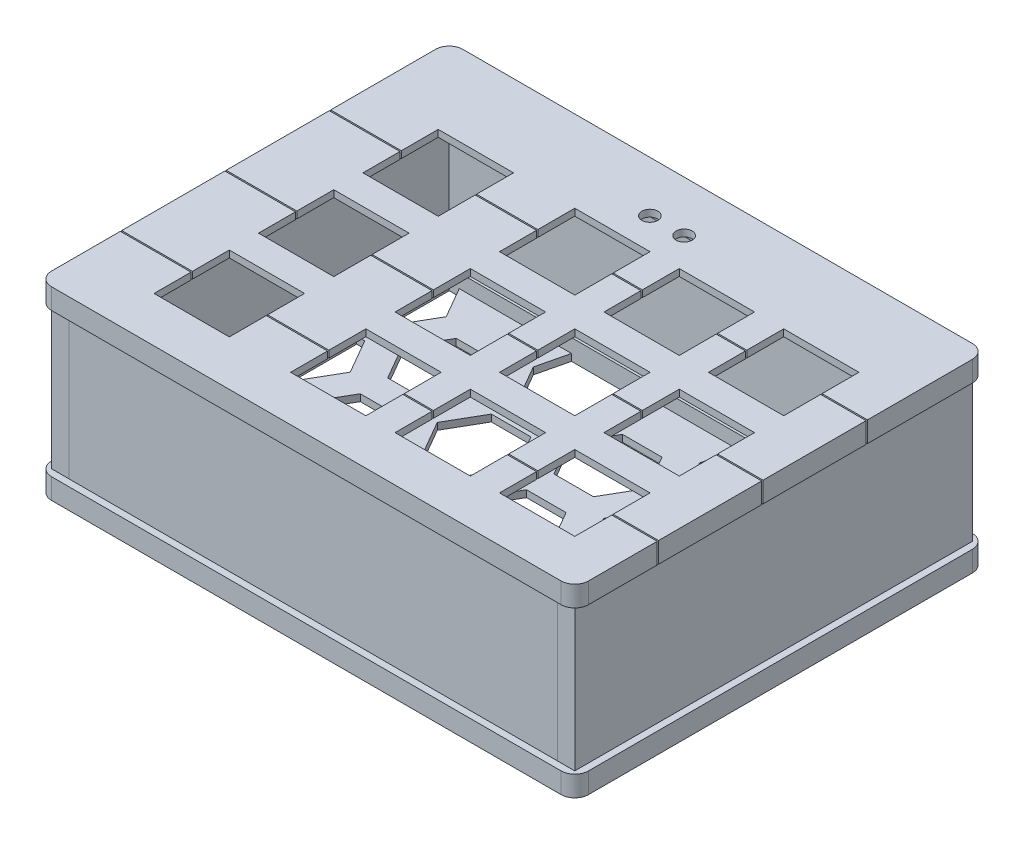
from build123d import *

# Parameters (mm, degrees)
SKETCH1_W               = 99.4664
SKETCH1_H               = 76.2
SKETCH1_W_2             = 13.9446
SKETCH1_H_2             = 13.9446
BOSS_EXTRUDE1_DEPTH     = 1.27
FILLET2_R               = 2.54
FILLET3_R               = 2.54
SKETCH15_W              = 96.9264
SKETCH15_H              = 73.66
SKETCH15_W_2            = 90.5764
SKETCH15_H_2            = 67.31
SKETCH15_W_3            = 88.0364
SKETCH15_H_3            = 64.77
BOSS_EXTRUDE6_DEPTH     = 2.54
SKETCH2_W               = 99.4664
SKETCH2_H               = 0.254
CUT_EXTRUDE_THIN2_DEPTH = 63.765574021
SKETCH10_W              = 94.3864
SKETCH10_H              = 76.2
BOSS_EXTRUDE4_DEPTH     = 1.27
SKETCH16_W              = 3.175
SKETCH16_H              = 73.66
BOSS_EXTRUDE7_DEPTH     = 31.75
BOSS_EXTRUDE7_2_DEPTH   = 31.75
SKETCH17_W              = 90.5764
SKETCH17_H              = 3.175
BOSS_EXTRUDE8_DEPTH     = 31.75
BOSS_EXTRUDE8_2_DEPTH   = 31.75
SKETCH18_W              = 88.0364
SKETCH18_H              = 64.77
BOSS_EXTRUDE9_DEPTH     = 1.27
SKETCH19_W              = 96.9264
SKETCH19_H              = 73.66
SKETCH19_W_2            = 90.5764
SKETCH19_H_2            = 67.31
SKETCH19_W_3            = 88.0364
SKETCH19_H_3            = 64.77
BOSS_EXTRUDE10_DEPTH    = 2.54
BOSS_EXTRUDE11_START    = -1.27
BOSS_EXTRUDE11_DEPTH    = 1.27
SKETCH21_W              = 11.43
SKETCH21_H              = 6.985
CUT_EXTRUDE2_DEPTH      = 3.175
SKETCH22_R              = 1.4859
CUT_EXTRUDE3_DEPTH      = 1.27


# Read off the part's stored shape, not the designer's step: Boss-Extrude11
with BuildPart() as part:
    # Sketch1 → Boss-Extrude1 (new body)
    with BuildSketch(Plane(origin=(0, 0, 0), x_dir=(1, 0, 0), z_dir=(0, 1, 0))):
        Rectangle(SKETCH1_W, SKETCH1_H)
        with Locations((-4.3688, 16.002)):
            Rectangle(SKETCH1_W_2, SKETCH1_H_2, mode=Mode.SUBTRACT)
        with Locations((14.986, 16.002)):
            Rectangle(SKETCH1_W_2, SKETCH1_H_2, mode=Mode.SUBTRACT)
        with Locations((34.3408, 16.002)):
            Rectangle(SKETCH1_W_2, SKETCH1_H_2, mode=Mode.SUBTRACT)
        with Locations((-4.3688, -3.3528)):
            Rectangle(SKETCH1_W_2, SKETCH1_H_2, mode=Mode.SUBTRACT)
        with Locations((14.986, -3.3528)):
            Rectangle(SKETCH1_W_2, SKETCH1_H_2, mode=Mode.SUBTRACT)
        with Locations((34.3408, -3.3528)):
            Rectangle(SKETCH1_W_2, SKETCH1_H_2, mode=Mode.SUBTRACT)
        with Locations((-4.3688, -22.7076)):
            Rectangle(SKETCH1_W_2, SKETCH1_H_2, mode=Mode.SUBTRACT)
        with Locations((14.986, -22.7076)):
            Rectangle(SKETCH1_W_2, SKETCH1_H_2, mode=Mode.SUBTRACT)
        with Locations((34.3408, -22.7076)):
            Rectangle(SKETCH1_W_2, SKETCH1_H_2, mode=Mode.SUBTRACT)
        with Locations((-29.6672, 16.002)):
            Rectangle(SKETCH1_W_2, SKETCH1_H_2, mode=Mode.SUBTRACT)
        with Locations((-29.6672, -3.3528)):
            Rectangle(SKETCH1_W_2, SKETCH1_H_2, mode=Mode.SUBTRACT)
        with Locations((-29.6672, -22.7076)):
            Rectangle(SKETCH1_W_2, SKETCH1_H_2, mode=Mode.SUBTRACT)
    extrude(amount=BOSS_EXTRUDE1_DEPTH)

    # Fillet2
    fillet2_edges = [part.edges().sort_by_distance(p)[0] for p in [
        (49.7332, 0.635, 38.1),
        (-49.7332, 0.635, 38.1),
    ]]
    fillet(fillet2_edges, radius=FILLET2_R)

    # Fillet3
    fillet3_edges = [part.edges().sort_by_distance(p)[0] for p in [
        (49.7332, 0.635, -38.1),
        (-49.7332, 0.635, -38.1),
    ]]
    fillet(fillet3_edges, radius=FILLET3_R)

    # Sketch15 → Boss-Extrude6 (add)
    # profile 1 of 2: a face of its own
    with BuildSketch(Plane.XZ):
        with BuildLine():
            Line((47.1932, 38.1), (-47.1932, 38.1))
            ThreePointArc((-47.1932, 38.1), (-48.989251224, 37.356051224), (-49.7332, 35.56))
            Line((-49.7332, 35.56), (-49.7332, -35.56))
            ThreePointArc((-49.7332, -35.56), (-48.989251224, -37.356051224), (-47.1932, -38.1))
            Line((-47.1932, -38.1), (47.1932, -38.1))
            ThreePointArc((47.1932, -38.1), (48.989251224, -37.356051224), (49.7332, -35.56))
            Line((49.7332, -35.56), (49.7332, 35.56))
            ThreePointArc((49.7332, 35.56), (48.989251224, 37.356051224), (47.1932, 38.1))
        make_face()
        Rectangle(SKETCH15_W, SKETCH15_H, mode=Mode.SUBTRACT)
    # profile 2 of 2: a face of its own
    with BuildSketch(Plane.XZ):
        Rectangle(SKETCH15_W_2, SKETCH15_H_2)
        Rectangle(SKETCH15_W_3, SKETCH15_H_3, mode=Mode.SUBTRACT)
    extrude(amount=BOSS_EXTRUDE6_DEPTH)

    # Sketch2 → Cut-Extrude-Thin2 (cut, through all)
    with BuildSketch(Plane(origin=(0, 1.27, 0), x_dir=(1, 0, 0), z_dir=(0, 1, 0))):
        with Locations((0, 16.002)):
            Rectangle(SKETCH2_W, SKETCH2_H)
        with Locations((0, -3.3528)):
            Rectangle(SKETCH2_W, SKETCH2_H)
        with Locations((0, -22.7076)):
            Rectangle(SKETCH2_W, SKETCH2_H)
    extrude(amount=-CUT_EXTRUDE_THIN2_DEPTH, mode=Mode.SUBTRACT)


with BuildPart() as cut_extrude_thin2_piece_1:
    # of the separate pieces the step leaves, piece 1, a body of its own (cut_extrude_thin2_pieces)
    add(part.part.solids().sort_by_distance((-48.4632, 0, -36.83))[0])

    # Sketch22 → Cut-Extrude3 (cut)
    with BuildSketch(Plane.XZ):
        with Locations(Location((-3.175, -28.7147, 0), (0, 0, 270))):
            Circle(SKETCH22_R)
        with Locations(Location((3.175, -28.7147, 0), (0, 0, 270))):
            Circle(SKETCH22_R)
    extrude(amount=-CUT_EXTRUDE3_DEPTH, mode=Mode.SUBTRACT)


with BuildPart() as cut_extrude_thin2_piece_2:
    # of the separate pieces the step leaves, piece 2, a body of its own (cut_extrude_thin2_pieces)
    add(part.part.solids().sort_by_distance((-48.4632, 0, 22.8346))[0])


with BuildPart() as cut_extrude_thin2_piece_3:
    # of the separate pieces the step leaves, piece 3, a body of its own (cut_extrude_thin2_pieces)
    add(part.part.solids().sort_by_distance((-48.4632, 0, -15.875))[0])


with BuildPart() as cut_extrude_thin2_piece_4:
    # of the separate pieces the step leaves, piece 4, a body of its own (cut_extrude_thin2_pieces)
    add(part.part.solids().sort_by_distance((-48.4632, 0, 3.4798))[0])


with BuildPart() as body_5:
    # Sketch10 → Boss-Extrude4 (new body)
    with BuildSketch(Plane(origin=(0, -31.75, 0), x_dir=(-1, 0, 0), z_dir=(0, -1, 0))):
        Rectangle(SKETCH10_W, SKETCH10_H)
    extrude(amount=-BOSS_EXTRUDE4_DEPTH)


with BuildPart() as body_6:
    # Sketch16 → Boss-Extrude7 (new body)
    with BuildSketch(Plane.XZ):
        with Locations((-46.8757, 0)):
            Rectangle(SKETCH16_W, SKETCH16_H)
    extrude(amount=BOSS_EXTRUDE7_DEPTH)

    # Sketch21 → Cut-Extrude2 (cut)
    with BuildSketch(Plane.ZY.offset(48.4632)):
        with Locations((0, -25.7175)):
            Rectangle(SKETCH21_W, SKETCH21_H)
    extrude(amount=-CUT_EXTRUDE2_DEPTH, mode=Mode.SUBTRACT)


with BuildPart() as body_7:
    # Sketch16 → Boss-Extrude7 2 (new body)
    with BuildSketch(Plane.XZ):
        with Locations((46.8757, 0)):
            Rectangle(SKETCH16_W, SKETCH16_H)
    extrude(amount=BOSS_EXTRUDE7_2_DEPTH)


with BuildPart() as body_8:
    # Sketch17 → Boss-Extrude8 (new body)
    with BuildSketch(Plane.XZ.offset(31.75)):
        with Locations((0, 35.2425)):
            Rectangle(SKETCH17_W, SKETCH17_H)
    extrude(amount=-BOSS_EXTRUDE8_DEPTH)


with BuildPart() as body_9:
    # Sketch17 → Boss-Extrude8 2 (new body)
    with BuildSketch(Plane.XZ.offset(31.75)):
        with Locations((0, -35.2425)):
            Rectangle(SKETCH17_W, SKETCH17_H)
    extrude(amount=-BOSS_EXTRUDE8_2_DEPTH)


with BuildPart() as body_10:
    # Sketch18 → Boss-Extrude9 (new body)
    with BuildSketch(Plane.XZ.offset(31.75)):
        with BuildLine():
            Line((-47.1932, -38.1), (47.1932, -38.1))
            ThreePointArc((47.1932, -38.1), (48.989251224, -37.356051224), (49.7332, -35.56))
            Line((49.7332, -35.56), (49.7332, 35.56))
            ThreePointArc((49.7332, 35.56), (48.989251224, 37.356051224), (47.1932, 38.1))
            Line((47.1932, 38.1), (-47.1932, 38.1))
            ThreePointArc((-47.1932, 38.1), (-48.989251224, 37.356051224), (-49.7332, 35.56))
            Line((-49.7332, 35.56), (-49.7332, -35.56))
            ThreePointArc((-49.7332, -35.56), (-48.989251224, -37.356051224), (-47.1932, -38.1))
        make_face()
        Rectangle(SKETCH18_W, SKETCH18_H, mode=Mode.SUBTRACT)
    extrude(amount=BOSS_EXTRUDE9_DEPTH)

    # Sketch19 → Boss-Extrude10 (add)
    # profile 1 of 2: a face of its own
    with BuildSketch(Plane(origin=(0, -31.75, 0), x_dir=(1, 0, 0), z_dir=(0, 1, 0))):
        with BuildLine():
            Line((47.1932, 38.1), (-47.1932, 38.1))
            ThreePointArc((-47.1932, 38.1), (-48.989251224, 37.356051224), (-49.7332, 35.56))
            Line((-49.7332, 35.56), (-49.7332, -35.56))
            ThreePointArc((-49.7332, -35.56), (-48.989251224, -37.356051224), (-47.1932, -38.1))
            Line((-47.1932, -38.1), (47.1932, -38.1))
            ThreePointArc((47.1932, -38.1), (48.989251224, -37.356051224), (49.7332, -35.56))
            Line((49.7332, -35.56), (49.7332, 35.56))
            ThreePointArc((49.7332, 35.56), (48.989251224, 37.356051224), (47.1932, 38.1))
        make_face()
        Rectangle(SKETCH19_W, SKETCH19_H, mode=Mode.SUBTRACT)
    # profile 2 of 2: a face of its own
    with BuildSketch(Plane(origin=(0, -31.75, 0), x_dir=(1, 0, 0), z_dir=(0, 1, 0))):
        Rectangle(SKETCH19_W_2, SKETCH19_H_2)
        Rectangle(SKETCH19_W_3, SKETCH19_H_3, mode=Mode.SUBTRACT)
    extrude(amount=BOSS_EXTRUDE10_DEPTH)

    # Boss-Extrude11 outline → Boss-Extrude11 (add)
    with BuildSketch(Plane.XZ.offset(33.02).offset(BOSS_EXTRUDE11_START)):
        Polygon((44.0182, -15.24), (42.527620829, -15.24), (38.861446619, -8.89), (42.527620829, -2.54), (44.0182, -2.54), (44.0182, 2.54), (42.527620829, 2.54), (38.861446619, 8.89), (42.527620829, 15.24), (44.0182, 15.24), (44.0182, 20.32), (42.527620829, 20.32), (38.861446619, 26.67), (42.161003408, 32.385), (19.43072331, 32.385), (22.730280098, 26.67), (19.064105889, 20.32), (11.73175747, 20.32), (8.065583261, 26.67), (11.365140049, 32.385), (-11.365140049, 32.385), (-8.065583261, 26.67), (-11.73175747, 20.32), (-19.064090972, 20.32), (-22.730265181, 26.67), (-19.430708393, 32.385), (-42.160988491, 32.385), (-38.861431703, 26.67), (-42.527609641, 20.319993541), (-44.0182, 20.319993541), (-44.0182, 15.24), (-42.527605912, 15.24), (-38.861431703, 8.89), (-42.527609641, 2.539993541), (-44.0182, 2.539993541), (-44.0182, -2.54), (-42.527605912, -2.54), (-38.861431703, -8.89), (-42.527609641, -15.240006459), (-44.0182, -15.240006459), (-44.0182, -20.32), (-42.527605912, -20.32), (-38.861431703, -26.67), (-42.160988491, -32.385), (-21.366463292, -32.385), (-22.730280098, -26.67), (-19.064105889, -20.32), (-11.73175747, -20.32), (-8.065583261, -26.67), (-9.429400066, -32.385), (9.429400066, -32.385), (8.065583261, -26.67), (11.73175747, -20.32), (19.064105889, -20.32), (22.730280098, -26.67), (21.366463292, -32.385), (40.225263425, -32.385), (38.861446619, -26.67), (42.527620829, -20.32), (44.0182, -20.32), align=None)
        Polygon((-34.462022651, -11.43), (-27.129674233, -11.43), (-23.463500023, -17.78), (-27.129674233, -24.13), (-34.462022651, -24.13), (-38.128196861, -17.78), align=None, mode=Mode.SUBTRACT)
        Polygon((-11.73175747, -15.24), (-19.064090972, -15.24), (-22.730265181, -8.89), (-19.064094701, -2.540006459), (-11.73175747, -2.54), (-8.065583261, -8.89), align=None, mode=Mode.SUBTRACT)
        Polygon((-3.666174209, -11.43), (3.666174209, -11.43), (7.332348419, -17.78), (3.666174209, -24.13), (-3.666174209, -24.13), (-7.332348419, -17.78), align=None, mode=Mode.SUBTRACT)
        Polygon((27.129689149, -11.43), (34.462037568, -11.43), (38.128211777, -17.78), (34.462037568, -24.13), (27.129689149, -24.13), (23.46351494, -17.78), align=None, mode=Mode.SUBTRACT)
        Polygon((19.064105889, -2.54), (22.730280098, -8.89), (19.064105889, -15.24), (11.73175747, -15.24), (8.065583261, -8.89), (11.73175747, -2.54), align=None, mode=Mode.SUBTRACT)
        Polygon((-27.129674233, -6.35), (-34.462022651, -6.35), (-38.128196861, 0), (-34.462022651, 6.35), (-27.129674233, 6.35), (-23.463500023, 0), align=None, mode=Mode.SUBTRACT)
        Polygon((-11.73175747, 15.24), (-8.065583261, 8.89), (-11.73175747, 2.54), (-19.064090972, 2.54), (-22.730265181, 8.89), (-19.064094701, 15.239993541), align=None, mode=Mode.SUBTRACT)
        Polygon((-34.462022651, 24.13), (-27.129674233, 24.13), (-23.463500023, 17.78), (-27.129674233, 11.43), (-34.462022651, 11.43), (-38.128196861, 17.78), align=None, mode=Mode.SUBTRACT)
        Polygon((3.666174209, -6.35), (-3.666174209, -6.35), (-7.332348419, 0), (-3.666174209, 6.35), (3.666174209, 6.35), (7.332348419, 0), align=None, mode=Mode.SUBTRACT)
        Polygon((22.730280098, 8.89), (19.064105889, 2.54), (11.73175747, 2.54), (8.065583261, 8.89), (11.73175747, 15.24), (19.064105889, 15.24), align=None, mode=Mode.SUBTRACT)
        Polygon((34.462037568, 6.35), (38.128211777, 0), (34.462037568, -6.35), (27.129689149, -6.35), (23.46351494, 0), (27.129689149, 6.35), align=None, mode=Mode.SUBTRACT)
        Polygon((3.666174209, 24.13), (7.332348419, 17.78), (3.666174209, 11.43), (-3.666174209, 11.43), (-7.332348419, 17.78), (-3.666174209, 24.13), align=None, mode=Mode.SUBTRACT)
        Polygon((38.128211777, 17.78), (34.462037568, 11.43), (27.129689149, 11.43), (23.46351494, 17.78), (27.129689149, 24.13), (34.462037568, 24.13), align=None, mode=Mode.SUBTRACT)
    extrude(amount=BOSS_EXTRUDE11_DEPTH)


solid = Compound([cut_extrude_thin2_piece_1.part, cut_extrude_thin2_piece_2.part, cut_extrude_thin2_piece_3.part, cut_extrude_thin2_piece_4.part, body_6.part, body_7.part, body_8.part, body_9.part, body_10.part])
